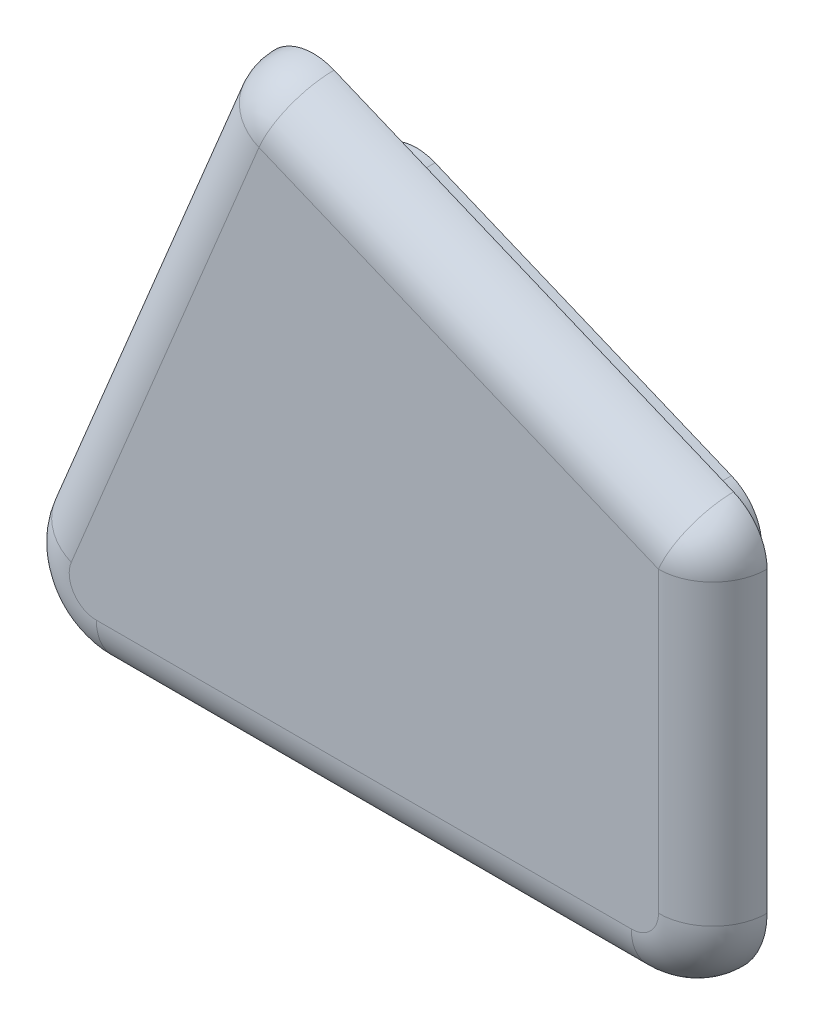
from build123d import *

# Parameters (mm, degrees)
BOSS_EXTRUDE1_DEPTH = 5
BOSS_EXTRUDE2_DEPTH = 5
FILLET1_R           = 5


with BuildPart() as part:
    # Sketch1 → Boss-Extrude1 (new body)
    # profile 1 of 3: a face of its own
    with BuildSketch(Plane.XY):
        with BuildLine():
            Line((32.146013204, 7.5), (32.146013204, 34.934018325))
            ThreePointArc((32.146013204, 34.934018325), (31.303361266, 37.71186949), (29.059430366, 39.553415988))
            Line((29.059430366, 39.553415988), (-7.718495765, 54.787331787))
            ThreePointArc((-7.718495765, 54.787331787), (-11.545330089, 54.787331787), (-14.25131059, 52.081351287))
            Line((-14.25131059, 52.081351287), (-31.528665913, 10.370125743))
            ThreePointArc((-31.528665913, 10.370125743), (-30.835591512, 3.333223252), (-24.599569419, 0))
            Line((-24.599569419, 0), (24.646013204, 0))
            ThreePointArc((24.646013204, 0), (29.949314063, 2.196699141), (32.146013204, 7.5))
        make_face()
        with BuildLine():
            ThreePointArc((27.146013204, 31.593125136), (26.303361266, 34.370976301), (24.059430366, 36.212522798))
            Line((24.059430366, 36.212522798), (-3.230262498, 47.516283695))
            ThreePointArc((-3.230262498, 47.516283695), (-7.057096821, 47.516283695), (-9.763077322, 44.810303195))
            Line((-9.763077322, 44.810303195), (-23.212969116, 12.339392013))
            ThreePointArc((-23.212969116, 12.339392013), (-22.889534395, 9.055504184), (-19.979390752, 7.5))
            Line((-19.979390752, 7.5), (19.646013204, 7.5))
            ThreePointArc((19.646013204, 7.5), (24.949314063, 9.696699141), (27.146013204, 15))
            Line((27.146013204, 15), (27.146013204, 31.593125136))
        make_face(mode=Mode.SUBTRACT)
    # profile 2 of 3: a face of its own
    with BuildSketch(Plane.XY):
        with BuildLine():
            Line((27.146013204, 31.593125136), (27.146013204, 15))
            ThreePointArc((27.146013204, 15), (24.949314063, 9.696699141), (19.646013204, 7.5))
            Line((19.646013204, 7.5), (-19.979390752, 7.5))
            ThreePointArc((-19.979390752, 7.5), (-22.889534395, 9.055504184), (-23.212969116, 12.339392013))
            Line((-23.212969116, 12.339392013), (-9.763077322, 44.810303195))
            ThreePointArc((-9.763077322, 44.810303195), (-7.057096821, 47.516283695), (-3.230262498, 47.516283695))
            Line((-3.230262498, 47.516283695), (24.059430366, 36.212522798))
            ThreePointArc((24.059430366, 36.212522798), (26.303361266, 34.370976301), (27.146013204, 31.593125136))
        make_face()
    # profile 3 of 3: a face of its own
    with BuildSketch(Plane.XY):
        with BuildLine():
            Line((26.646013204, 31.593125136), (26.646013204, 15))
            ThreePointArc((26.646013204, 15), (24.595760673, 10.050252532), (19.646013204, 8))
            Line((19.646013204, 8), (-19.979390752, 8))
            ThreePointArc((-19.979390752, 8), (-22.473799589, 9.333289301), (-22.75102935, 12.148050297))
            Line((-22.75102935, 12.148050297), (-9.301137556, 44.618961479))
            ThreePointArc((-9.301137556, 44.618961479), (-6.865755105, 47.054343929), (-3.421604214, 47.054343929))
            Line((-3.421604214, 47.054343929), (23.86808865, 35.750583032))
            ThreePointArc((23.86808865, 35.750583032), (25.88762646, 34.093191184), (26.646013204, 31.593125136))
        make_face()
    extrude(amount=BOSS_EXTRUDE1_DEPTH)

    # Sketch1<4> → Boss-Extrude2 (add)
    with BuildSketch(Plane.XY):
        with BuildLine():
            Line((26.646013204, 31.593125136), (26.646013204, 15))
            ThreePointArc((26.646013204, 15), (24.595760673, 10.050252532), (19.646013204, 8))
            Line((19.646013204, 8), (-19.979390752, 8))
            ThreePointArc((-19.979390752, 8), (-22.473799589, 9.333289301), (-22.75102935, 12.148050297))
            Line((-22.75102935, 12.148050297), (-9.301137556, 44.618961479))
            ThreePointArc((-9.301137556, 44.618961479), (-6.865755105, 47.054343929), (-3.421604214, 47.054343929))
            Line((-3.421604214, 47.054343929), (23.86808865, 35.750583032))
            ThreePointArc((23.86808865, 35.750583032), (25.88762646, 34.093191184), (26.646013204, 31.593125136))
        make_face()
    extrude(amount=-BOSS_EXTRUDE2_DEPTH)

    # Fillet1
    fillet1_edges = [part.edges().sort_by_distance(p)[0] for p in [
        (29.949314063, 2.196699141, 5),
        (0.023221893, 0, 5),
        (-30.835591512, 3.333223252, 5),
        (-22.889988251, 31.225738515, 5),
        (-11.545330089, 54.787331787, 5),
        (10.670467301, 47.170373888, 5),
        (31.303361266, 37.71186949, 5),
        (32.146013204, 21.217009163, 5),
    ]]
    fillet(fillet1_edges, radius=FILLET1_R - 0.0001)  # a hair under: the kernel refuses the full size


solid = part.part
